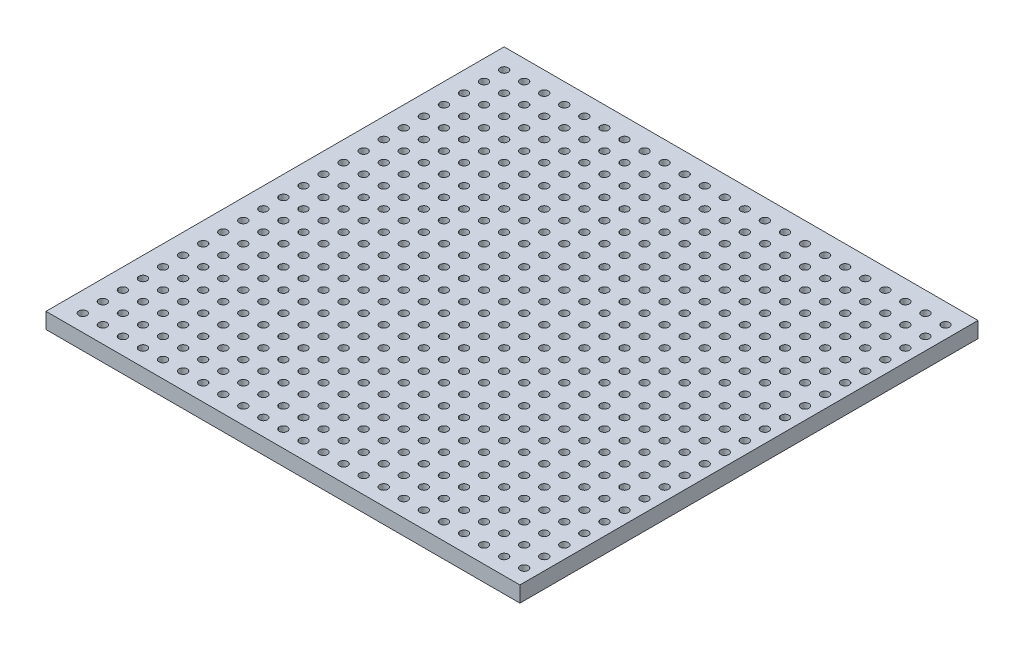
from build123d import *

# Parameters (mm, degrees)
SKETCH1_W           = 60
SKETCH1_H           = 58
BOSS_EXTRUDE1_DEPTH = 2
SKETCH2_R           = 0.51
CUT_EXTRUDE1_DEPTH  = 2


with BuildPart() as part:
    # Sketch1 → Boss-Extrude1 (new body)
    with BuildSketch(Plane(origin=(0, 0, 0), x_dir=(1, 0, 0), z_dir=(0, 1, 0))):
        Rectangle(SKETCH1_W, SKETCH1_H)
    extrude(amount=BOSS_EXTRUDE1_DEPTH)

    # Sketch2 → Cut-Extrude1 (cut)
    with BuildSketch(Plane(origin=(0, 2, 0), x_dir=(1, 0, 0), z_dir=(0, 1, 0))):
        with Locations(Location((-27.46, 26.46, 0), (0, 0, 270))):
            Circle(SKETCH2_R)
        with Locations(Location((-27.46, 23.92, 0), (0, 0, 270))):
            Circle(SKETCH2_R)
        with Locations(Location((-27.46, 21.38, 0), (0, 0, 270))):
            Circle(SKETCH2_R)
        with Locations(Location((-27.46, 18.84, 0), (0, 0, 270))):
            Circle(SKETCH2_R)
        with Locations(Location((-27.46, 16.3, 0), (0, 0, 270))):
            Circle(SKETCH2_R)
        with Locations(Location((-27.46, 13.76, 0), (0, 0, 270))):
            Circle(SKETCH2_R)
        with Locations(Location((-27.46, 11.22, 0), (0, 0, 270))):
            Circle(SKETCH2_R)
        with Locations(Location((-27.46, 8.68, 0), (0, 0, 270))):
            Circle(SKETCH2_R)
        with Locations(Location((-27.46, 6.14, 0), (0, 0, 270))):
            Circle(SKETCH2_R)
        with Locations(Location((-27.46, 3.6, 0), (0, 0, 270))):
            Circle(SKETCH2_R)
        with Locations(Location((-27.46, 1.06, 0), (0, 0, 270))):
            Circle(SKETCH2_R)
        with Locations(Location((-27.46, -1.48, 0), (0, 0, 270))):
            Circle(SKETCH2_R)
        with Locations(Location((-24.92, 26.46, 0), (0, 0, 270))):
            Circle(SKETCH2_R)
        with Locations(Location((-24.92, 23.92, 0), (0, 0, 270))):
            Circle(SKETCH2_R)
        with Locations(Location((-24.92, 21.38, 0), (0, 0, 270))):
            Circle(SKETCH2_R)
        with Locations(Location((-24.92, 18.84, 0), (0, 0, 270))):
            Circle(SKETCH2_R)
        with Locations(Location((-24.92, 16.3, 0), (0, 0, 270))):
            Circle(SKETCH2_R)
        with Locations(Location((-24.92, 13.76, 0), (0, 0, 270))):
            Circle(SKETCH2_R)
        with Locations(Location((-24.92, 11.22, 0), (0, 0, 270))):
            Circle(SKETCH2_R)
        with Locations(Location((-24.92, 8.68, 0), (0, 0, 270))):
            Circle(SKETCH2_R)
        with Locations(Location((-24.92, 6.14, 0), (0, 0, 270))):
            Circle(SKETCH2_R)
        with Locations(Location((-24.92, 3.6, 0), (0, 0, 270))):
            Circle(SKETCH2_R)
        with Locations(Location((-24.92, 1.06, 0), (0, 0, 270))):
            Circle(SKETCH2_R)
        with Locations(Location((-24.92, -1.48, 0), (0, 0, 270))):
            Circle(SKETCH2_R)
        with Locations(Location((-22.38, 26.46, 0), (0, 0, 270))):
            Circle(SKETCH2_R)
        with Locations(Location((-22.38, 23.92, 0), (0, 0, 270))):
            Circle(SKETCH2_R)
        with Locations(Location((-22.38, 21.38, 0), (0, 0, 270))):
            Circle(SKETCH2_R)
        with Locations(Location((-22.38, 18.84, 0), (0, 0, 270))):
            Circle(SKETCH2_R)
        with Locations(Location((-22.38, 16.3, 0), (0, 0, 270))):
            Circle(SKETCH2_R)
        with Locations(Location((-22.38, 13.76, 0), (0, 0, 270))):
            Circle(SKETCH2_R)
        with Locations(Location((-22.38, 11.22, 0), (0, 0, 270))):
            Circle(SKETCH2_R)
        with Locations(Location((-22.38, 8.68, 0), (0, 0, 270))):
            Circle(SKETCH2_R)
        with Locations(Location((-22.38, 6.14, 0), (0, 0, 270))):
            Circle(SKETCH2_R)
        with Locations(Location((-22.38, 3.6, 0), (0, 0, 270))):
            Circle(SKETCH2_R)
        with Locations(Location((-22.38, 1.06, 0), (0, 0, 270))):
            Circle(SKETCH2_R)
        with Locations(Location((-22.38, -1.48, 0), (0, 0, 270))):
            Circle(SKETCH2_R)
        with Locations(Location((-19.84, 26.46, 0), (0, 0, 270))):
            Circle(SKETCH2_R)
        with Locations(Location((-19.84, 23.92, 0), (0, 0, 270))):
            Circle(SKETCH2_R)
        with Locations(Location((-19.84, 21.38, 0), (0, 0, 270))):
            Circle(SKETCH2_R)
        with Locations(Location((-19.84, 18.84, 0), (0, 0, 270))):
            Circle(SKETCH2_R)
        with Locations(Location((-19.84, 16.3, 0), (0, 0, 270))):
            Circle(SKETCH2_R)
        with Locations(Location((-19.84, 13.76, 0), (0, 0, 270))):
            Circle(SKETCH2_R)
        with Locations(Location((-19.84, 11.22, 0), (0, 0, 270))):
            Circle(SKETCH2_R)
        with Locations(Location((-19.84, 8.68, 0), (0, 0, 270))):
            Circle(SKETCH2_R)
        with Locations(Location((-19.84, 6.14, 0), (0, 0, 270))):
            Circle(SKETCH2_R)
        with Locations(Location((-19.84, 3.6, 0), (0, 0, 270))):
            Circle(SKETCH2_R)
        with Locations(Location((-19.84, 1.06, 0), (0, 0, 270))):
            Circle(SKETCH2_R)
        with Locations(Location((-19.84, -1.48, 0), (0, 0, 270))):
            Circle(SKETCH2_R)
        with Locations(Location((-17.3, 26.46, 0), (0, 0, 270))):
            Circle(SKETCH2_R)
        with Locations(Location((-17.3, 23.92, 0), (0, 0, 270))):
            Circle(SKETCH2_R)
        with Locations(Location((-17.3, 21.38, 0), (0, 0, 270))):
            Circle(SKETCH2_R)
        with Locations(Location((-17.3, 18.84, 0), (0, 0, 270))):
            Circle(SKETCH2_R)
        with Locations(Location((-17.3, 16.3, 0), (0, 0, 270))):
            Circle(SKETCH2_R)
        with Locations(Location((-17.3, 13.76, 0), (0, 0, 270))):
            Circle(SKETCH2_R)
        with Locations(Location((-17.3, 11.22, 0), (0, 0, 270))):
            Circle(SKETCH2_R)
        with Locations(Location((-17.3, 8.68, 0), (0, 0, 270))):
            Circle(SKETCH2_R)
        with Locations(Location((-17.3, 6.14, 0), (0, 0, 270))):
            Circle(SKETCH2_R)
        with Locations(Location((-17.3, 3.6, 0), (0, 0, 270))):
            Circle(SKETCH2_R)
        with Locations(Location((-17.3, 1.06, 0), (0, 0, 270))):
            Circle(SKETCH2_R)
        with Locations(Location((-17.3, -1.48, 0), (0, 0, 270))):
            Circle(SKETCH2_R)
        with Locations(Location((-14.76, 26.46, 0), (0, 0, 270))):
            Circle(SKETCH2_R)
        with Locations(Location((-14.76, 23.92, 0), (0, 0, 270))):
            Circle(SKETCH2_R)
        with Locations(Location((-14.76, 21.38, 0), (0, 0, 270))):
            Circle(SKETCH2_R)
        with Locations(Location((-14.76, 18.84, 0), (0, 0, 270))):
            Circle(SKETCH2_R)
        with Locations(Location((-14.76, 16.3, 0), (0, 0, 270))):
            Circle(SKETCH2_R)
        with Locations(Location((-14.76, 13.76, 0), (0, 0, 270))):
            Circle(SKETCH2_R)
        with Locations(Location((-14.76, 11.22, 0), (0, 0, 270))):
            Circle(SKETCH2_R)
        with Locations(Location((-14.76, 8.68, 0), (0, 0, 270))):
            Circle(SKETCH2_R)
        with Locations(Location((-14.76, 6.14, 0), (0, 0, 270))):
            Circle(SKETCH2_R)
        with Locations(Location((-14.76, 3.6, 0), (0, 0, 270))):
            Circle(SKETCH2_R)
        with Locations(Location((-14.76, 1.06, 0), (0, 0, 270))):
            Circle(SKETCH2_R)
        with Locations(Location((-14.76, -1.48, 0), (0, 0, 270))):
            Circle(SKETCH2_R)
        with Locations(Location((-12.22, 26.46, 0), (0, 0, 270))):
            Circle(SKETCH2_R)
        with Locations(Location((-12.22, 23.92, 0), (0, 0, 270))):
            Circle(SKETCH2_R)
        with Locations(Location((-12.22, 21.38, 0), (0, 0, 270))):
            Circle(SKETCH2_R)
        with Locations(Location((-12.22, 18.84, 0), (0, 0, 270))):
            Circle(SKETCH2_R)
        with Locations(Location((-12.22, 16.3, 0), (0, 0, 270))):
            Circle(SKETCH2_R)
        with Locations(Location((-12.22, 13.76, 0), (0, 0, 270))):
            Circle(SKETCH2_R)
        with Locations(Location((-12.22, 11.22, 0), (0, 0, 270))):
            Circle(SKETCH2_R)
        with Locations(Location((-12.22, 8.68, 0), (0, 0, 270))):
            Circle(SKETCH2_R)
        with Locations(Location((-12.22, 6.14, 0), (0, 0, 270))):
            Circle(SKETCH2_R)
        with Locations(Location((-12.22, 3.6, 0), (0, 0, 270))):
            Circle(SKETCH2_R)
        with Locations(Location((-12.22, 1.06, 0), (0, 0, 270))):
            Circle(SKETCH2_R)
        with Locations(Location((-12.22, -1.48, 0), (0, 0, 270))):
            Circle(SKETCH2_R)
        with Locations(Location((-9.68, 26.46, 0), (0, 0, 270))):
            Circle(SKETCH2_R)
        with Locations(Location((-9.68, 23.92, 0), (0, 0, 270))):
            Circle(SKETCH2_R)
        with Locations(Location((-9.68, 21.38, 0), (0, 0, 270))):
            Circle(SKETCH2_R)
        with Locations(Location((-9.68, 18.84, 0), (0, 0, 270))):
            Circle(SKETCH2_R)
        with Locations(Location((-9.68, 16.3, 0), (0, 0, 270))):
            Circle(SKETCH2_R)
        with Locations(Location((-9.68, 13.76, 0), (0, 0, 270))):
            Circle(SKETCH2_R)
        with Locations(Location((-9.68, 11.22, 0), (0, 0, 270))):
            Circle(SKETCH2_R)
        with Locations(Location((-9.68, 8.68, 0), (0, 0, 270))):
            Circle(SKETCH2_R)
        with Locations(Location((-9.68, 6.14, 0), (0, 0, 270))):
            Circle(SKETCH2_R)
        with Locations(Location((-9.68, 3.6, 0), (0, 0, 270))):
            Circle(SKETCH2_R)
        with Locations(Location((-9.68, 1.06, 0), (0, 0, 270))):
            Circle(SKETCH2_R)
        with Locations(Location((-9.68, -1.48, 0), (0, 0, 270))):
            Circle(SKETCH2_R)
        with Locations(Location((-7.14, 26.46, 0), (0, 0, 270))):
            Circle(SKETCH2_R)
        with Locations(Location((-7.14, 23.92, 0), (0, 0, 270))):
            Circle(SKETCH2_R)
        with Locations(Location((-7.14, 21.38, 0), (0, 0, 270))):
            Circle(SKETCH2_R)
        with Locations(Location((-7.14, 18.84, 0), (0, 0, 270))):
            Circle(SKETCH2_R)
        with Locations(Location((-7.14, 16.3, 0), (0, 0, 270))):
            Circle(SKETCH2_R)
        with Locations(Location((-7.14, 13.76, 0), (0, 0, 270))):
            Circle(SKETCH2_R)
        with Locations(Location((-7.14, 11.22, 0), (0, 0, 270))):
            Circle(SKETCH2_R)
        with Locations(Location((-7.14, 8.68, 0), (0, 0, 270))):
            Circle(SKETCH2_R)
        with Locations(Location((-7.14, 6.14, 0), (0, 0, 270))):
            Circle(SKETCH2_R)
        with Locations(Location((-7.14, 3.6, 0), (0, 0, 270))):
            Circle(SKETCH2_R)
        with Locations(Location((-7.14, 1.06, 0), (0, 0, 270))):
            Circle(SKETCH2_R)
        with Locations(Location((-7.14, -1.48, 0), (0, 0, 270))):
            Circle(SKETCH2_R)
        with Locations(Location((-4.6, 26.46, 0), (0, 0, 270))):
            Circle(SKETCH2_R)
        with Locations(Location((-4.6, 23.92, 0), (0, 0, 270))):
            Circle(SKETCH2_R)
        with Locations(Location((-4.6, 21.38, 0), (0, 0, 270))):
            Circle(SKETCH2_R)
        with Locations(Location((-4.6, 18.84, 0), (0, 0, 270))):
            Circle(SKETCH2_R)
        with Locations(Location((-4.6, 16.3, 0), (0, 0, 270))):
            Circle(SKETCH2_R)
        with Locations(Location((-4.6, 13.76, 0), (0, 0, 270))):
            Circle(SKETCH2_R)
        with Locations(Location((-4.6, 11.22, 0), (0, 0, 270))):
            Circle(SKETCH2_R)
        with Locations(Location((-4.6, 8.68, 0), (0, 0, 270))):
            Circle(SKETCH2_R)
        with Locations(Location((-4.6, 6.14, 0), (0, 0, 270))):
            Circle(SKETCH2_R)
        with Locations(Location((-4.6, 3.6, 0), (0, 0, 270))):
            Circle(SKETCH2_R)
        with Locations(Location((-4.6, 1.06, 0), (0, 0, 270))):
            Circle(SKETCH2_R)
        with Locations(Location((-4.6, -1.48, 0), (0, 0, 270))):
            Circle(SKETCH2_R)
        with Locations(Location((-2.06, 26.46, 0), (0, 0, 270))):
            Circle(SKETCH2_R)
        with Locations(Location((-2.06, 23.92, 0), (0, 0, 270))):
            Circle(SKETCH2_R)
        with Locations(Location((-2.06, 21.38, 0), (0, 0, 270))):
            Circle(SKETCH2_R)
        with Locations(Location((-2.06, 18.84, 0), (0, 0, 270))):
            Circle(SKETCH2_R)
        with Locations(Location((-2.06, 16.3, 0), (0, 0, 270))):
            Circle(SKETCH2_R)
        with Locations(Location((-2.06, 13.76, 0), (0, 0, 270))):
            Circle(SKETCH2_R)
        with Locations(Location((-2.06, 11.22, 0), (0, 0, 270))):
            Circle(SKETCH2_R)
        with Locations(Location((-2.06, 8.68, 0), (0, 0, 270))):
            Circle(SKETCH2_R)
        with Locations(Location((-2.06, 6.14, 0), (0, 0, 270))):
            Circle(SKETCH2_R)
        with Locations(Location((-2.06, 3.6, 0), (0, 0, 270))):
            Circle(SKETCH2_R)
        with Locations(Location((-2.06, 1.06, 0), (0, 0, 270))):
            Circle(SKETCH2_R)
        with Locations(Location((-2.06, -1.48, 0), (0, 0, 270))):
            Circle(SKETCH2_R)
        with Locations(Location((0.48, 26.46, 0), (0, 0, 270))):
            Circle(SKETCH2_R)
        with Locations(Location((0.48, 23.92, 0), (0, 0, 270))):
            Circle(SKETCH2_R)
        with Locations(Location((0.48, 21.38, 0), (0, 0, 270))):
            Circle(SKETCH2_R)
        with Locations(Location((0.48, 18.84, 0), (0, 0, 270))):
            Circle(SKETCH2_R)
        with Locations(Location((0.48, 16.3, 0), (0, 0, 270))):
            Circle(SKETCH2_R)
        with Locations(Location((0.48, 13.76, 0), (0, 0, 270))):
            Circle(SKETCH2_R)
        with Locations(Location((0.48, 11.22, 0), (0, 0, 270))):
            Circle(SKETCH2_R)
        with Locations(Location((0.48, 8.68, 0), (0, 0, 270))):
            Circle(SKETCH2_R)
        with Locations(Location((0.48, 6.14, 0), (0, 0, 270))):
            Circle(SKETCH2_R)
        with Locations(Location((0.48, 3.6, 0), (0, 0, 270))):
            Circle(SKETCH2_R)
        with Locations(Location((0.48, 1.06, 0), (0, 0, 270))):
            Circle(SKETCH2_R)
        with Locations(Location((0.48, -1.48, 0), (0, 0, 270))):
            Circle(SKETCH2_R)
        with Locations(Location((3.02, 26.46, 0), (0, 0, 270))):
            Circle(SKETCH2_R)
        with Locations(Location((3.02, 23.92, 0), (0, 0, 270))):
            Circle(SKETCH2_R)
        with Locations(Location((3.02, 21.38, 0), (0, 0, 270))):
            Circle(SKETCH2_R)
        with Locations(Location((3.02, 18.84, 0), (0, 0, 270))):
            Circle(SKETCH2_R)
        with Locations(Location((3.02, 16.3, 0), (0, 0, 270))):
            Circle(SKETCH2_R)
        with Locations(Location((3.02, 13.76, 0), (0, 0, 270))):
            Circle(SKETCH2_R)
        with Locations(Location((3.02, 11.22, 0), (0, 0, 270))):
            Circle(SKETCH2_R)
        with Locations(Location((3.02, 8.68, 0), (0, 0, 270))):
            Circle(SKETCH2_R)
        with Locations(Location((3.02, 6.14, 0), (0, 0, 270))):
            Circle(SKETCH2_R)
        with Locations(Location((3.02, 3.6, 0), (0, 0, 270))):
            Circle(SKETCH2_R)
        with Locations(Location((3.02, 1.06, 0), (0, 0, 270))):
            Circle(SKETCH2_R)
        with Locations(Location((3.02, -1.48, 0), (0, 0, 270))):
            Circle(SKETCH2_R)
        with Locations(Location((5.56, 26.46, 0), (0, 0, 270))):
            Circle(SKETCH2_R)
        with Locations(Location((5.56, 23.92, 0), (0, 0, 270))):
            Circle(SKETCH2_R)
        with Locations(Location((5.56, 21.38, 0), (0, 0, 270))):
            Circle(SKETCH2_R)
        with Locations(Location((5.56, 18.84, 0), (0, 0, 270))):
            Circle(SKETCH2_R)
        with Locations(Location((5.56, 16.3, 0), (0, 0, 270))):
            Circle(SKETCH2_R)
        with Locations(Location((5.56, 13.76, 0), (0, 0, 270))):
            Circle(SKETCH2_R)
        with Locations(Location((5.56, 11.22, 0), (0, 0, 270))):
            Circle(SKETCH2_R)
        with Locations(Location((5.56, 8.68, 0), (0, 0, 270))):
            Circle(SKETCH2_R)
        with Locations(Location((5.56, 6.14, 0), (0, 0, 270))):
            Circle(SKETCH2_R)
        with Locations(Location((5.56, 3.6, 0), (0, 0, 270))):
            Circle(SKETCH2_R)
        with Locations(Location((5.56, 1.06, 0), (0, 0, 270))):
            Circle(SKETCH2_R)
        with Locations(Location((5.56, -1.48, 0), (0, 0, 270))):
            Circle(SKETCH2_R)
        with Locations(Location((8.1, 26.46, 0), (0, 0, 270))):
            Circle(SKETCH2_R)
        with Locations(Location((8.1, 23.92, 0), (0, 0, 270))):
            Circle(SKETCH2_R)
        with Locations(Location((8.1, 21.38, 0), (0, 0, 270))):
            Circle(SKETCH2_R)
        with Locations(Location((8.1, 18.84, 0), (0, 0, 270))):
            Circle(SKETCH2_R)
        with Locations(Location((8.1, 16.3, 0), (0, 0, 270))):
            Circle(SKETCH2_R)
        with Locations(Location((8.1, 13.76, 0), (0, 0, 270))):
            Circle(SKETCH2_R)
        with Locations(Location((8.1, 11.22, 0), (0, 0, 270))):
            Circle(SKETCH2_R)
        with Locations(Location((8.1, 8.68, 0), (0, 0, 270))):
            Circle(SKETCH2_R)
        with Locations(Location((8.1, 6.14, 0), (0, 0, 270))):
            Circle(SKETCH2_R)
        with Locations(Location((8.1, 3.6, 0), (0, 0, 270))):
            Circle(SKETCH2_R)
        with Locations(Location((8.1, 1.06, 0), (0, 0, 270))):
            Circle(SKETCH2_R)
        with Locations(Location((8.1, -1.48, 0), (0, 0, 270))):
            Circle(SKETCH2_R)
        with Locations(Location((10.64, 26.46, 0), (0, 0, 270))):
            Circle(SKETCH2_R)
        with Locations(Location((10.64, 23.92, 0), (0, 0, 270))):
            Circle(SKETCH2_R)
        with Locations(Location((10.64, 21.38, 0), (0, 0, 270))):
            Circle(SKETCH2_R)
        with Locations(Location((10.64, 18.84, 0), (0, 0, 270))):
            Circle(SKETCH2_R)
        with Locations(Location((10.64, 16.3, 0), (0, 0, 270))):
            Circle(SKETCH2_R)
        with Locations(Location((10.64, 13.76, 0), (0, 0, 270))):
            Circle(SKETCH2_R)
        with Locations(Location((10.64, 11.22, 0), (0, 0, 270))):
            Circle(SKETCH2_R)
        with Locations(Location((10.64, 8.68, 0), (0, 0, 270))):
            Circle(SKETCH2_R)
        with Locations(Location((10.64, 6.14, 0), (0, 0, 270))):
            Circle(SKETCH2_R)
        with Locations(Location((10.64, 3.6, 0), (0, 0, 270))):
            Circle(SKETCH2_R)
        with Locations(Location((10.64, 1.06, 0), (0, 0, 270))):
            Circle(SKETCH2_R)
        with Locations(Location((10.64, -1.48, 0), (0, 0, 270))):
            Circle(SKETCH2_R)
        with Locations(Location((13.18, 26.46, 0), (0, 0, 270))):
            Circle(SKETCH2_R)
        with Locations(Location((13.18, 23.92, 0), (0, 0, 270))):
            Circle(SKETCH2_R)
        with Locations(Location((13.18, 21.38, 0), (0, 0, 270))):
            Circle(SKETCH2_R)
        with Locations(Location((13.18, 18.84, 0), (0, 0, 270))):
            Circle(SKETCH2_R)
        with Locations(Location((13.18, 16.3, 0), (0, 0, 270))):
            Circle(SKETCH2_R)
        with Locations(Location((13.18, 13.76, 0), (0, 0, 270))):
            Circle(SKETCH2_R)
        with Locations(Location((13.18, 11.22, 0), (0, 0, 270))):
            Circle(SKETCH2_R)
        with Locations(Location((13.18, 8.68, 0), (0, 0, 270))):
            Circle(SKETCH2_R)
        with Locations(Location((13.18, 6.14, 0), (0, 0, 270))):
            Circle(SKETCH2_R)
        with Locations(Location((13.18, 3.6, 0), (0, 0, 270))):
            Circle(SKETCH2_R)
        with Locations(Location((13.18, 1.06, 0), (0, 0, 270))):
            Circle(SKETCH2_R)
        with Locations(Location((13.18, -1.48, 0), (0, 0, 270))):
            Circle(SKETCH2_R)
        with Locations(Location((15.72, 26.46, 0), (0, 0, 270))):
            Circle(SKETCH2_R)
        with Locations(Location((15.72, 23.92, 0), (0, 0, 270))):
            Circle(SKETCH2_R)
        with Locations(Location((15.72, 21.38, 0), (0, 0, 270))):
            Circle(SKETCH2_R)
        with Locations(Location((15.72, 18.84, 0), (0, 0, 270))):
            Circle(SKETCH2_R)
        with Locations(Location((15.72, 16.3, 0), (0, 0, 270))):
            Circle(SKETCH2_R)
        with Locations(Location((15.72, 13.76, 0), (0, 0, 270))):
            Circle(SKETCH2_R)
        with Locations(Location((15.72, 11.22, 0), (0, 0, 270))):
            Circle(SKETCH2_R)
        with Locations(Location((15.72, 8.68, 0), (0, 0, 270))):
            Circle(SKETCH2_R)
        with Locations(Location((15.72, 6.14, 0), (0, 0, 270))):
            Circle(SKETCH2_R)
        with Locations(Location((15.72, 3.6, 0), (0, 0, 270))):
            Circle(SKETCH2_R)
        with Locations(Location((15.72, 1.06, 0), (0, 0, 270))):
            Circle(SKETCH2_R)
        with Locations(Location((15.72, -1.48, 0), (0, 0, 270))):
            Circle(SKETCH2_R)
        with Locations(Location((18.26, 26.46, 0), (0, 0, 270))):
            Circle(SKETCH2_R)
        with Locations(Location((18.26, 23.92, 0), (0, 0, 270))):
            Circle(SKETCH2_R)
        with Locations(Location((18.26, 21.38, 0), (0, 0, 270))):
            Circle(SKETCH2_R)
        with Locations(Location((18.26, 18.84, 0), (0, 0, 270))):
            Circle(SKETCH2_R)
        with Locations(Location((18.26, 16.3, 0), (0, 0, 270))):
            Circle(SKETCH2_R)
        with Locations(Location((18.26, 13.76, 0), (0, 0, 270))):
            Circle(SKETCH2_R)
        with Locations(Location((18.26, 11.22, 0), (0, 0, 270))):
            Circle(SKETCH2_R)
        with Locations(Location((18.26, 8.68, 0), (0, 0, 270))):
            Circle(SKETCH2_R)
        with Locations(Location((18.26, 6.14, 0), (0, 0, 270))):
            Circle(SKETCH2_R)
        with Locations(Location((18.26, 3.6, 0), (0, 0, 270))):
            Circle(SKETCH2_R)
        with Locations(Location((18.26, 1.06, 0), (0, 0, 270))):
            Circle(SKETCH2_R)
        with Locations(Location((18.26, -1.48, 0), (0, 0, 270))):
            Circle(SKETCH2_R)
        with Locations(Location((20.8, 26.46, 0), (0, 0, 270))):
            Circle(SKETCH2_R)
        with Locations(Location((20.8, 23.92, 0), (0, 0, 270))):
            Circle(SKETCH2_R)
        with Locations(Location((20.8, 21.38, 0), (0, 0, 270))):
            Circle(SKETCH2_R)
        with Locations(Location((20.8, 18.84, 0), (0, 0, 270))):
            Circle(SKETCH2_R)
        with Locations(Location((20.8, 16.3, 0), (0, 0, 270))):
            Circle(SKETCH2_R)
        with Locations(Location((20.8, 13.76, 0), (0, 0, 270))):
            Circle(SKETCH2_R)
        with Locations(Location((20.8, 11.22, 0), (0, 0, 270))):
            Circle(SKETCH2_R)
        with Locations(Location((20.8, 8.68, 0), (0, 0, 270))):
            Circle(SKETCH2_R)
        with Locations(Location((20.8, 6.14, 0), (0, 0, 270))):
            Circle(SKETCH2_R)
        with Locations(Location((20.8, 3.6, 0), (0, 0, 270))):
            Circle(SKETCH2_R)
        with Locations(Location((20.8, 1.06, 0), (0, 0, 270))):
            Circle(SKETCH2_R)
        with Locations(Location((20.8, -1.48, 0), (0, 0, 270))):
            Circle(SKETCH2_R)
        with Locations(Location((23.34, 26.46, 0), (0, 0, 270))):
            Circle(SKETCH2_R)
        with Locations(Location((23.34, 23.92, 0), (0, 0, 270))):
            Circle(SKETCH2_R)
        with Locations(Location((23.34, 21.38, 0), (0, 0, 270))):
            Circle(SKETCH2_R)
        with Locations(Location((23.34, 18.84, 0), (0, 0, 270))):
            Circle(SKETCH2_R)
        with Locations(Location((23.34, 16.3, 0), (0, 0, 270))):
            Circle(SKETCH2_R)
        with Locations(Location((23.34, 13.76, 0), (0, 0, 270))):
            Circle(SKETCH2_R)
        with Locations(Location((23.34, 11.22, 0), (0, 0, 270))):
            Circle(SKETCH2_R)
        with Locations(Location((23.34, 8.68, 0), (0, 0, 270))):
            Circle(SKETCH2_R)
        with Locations(Location((23.34, 6.14, 0), (0, 0, 270))):
            Circle(SKETCH2_R)
        with Locations(Location((23.34, 3.6, 0), (0, 0, 270))):
            Circle(SKETCH2_R)
        with Locations(Location((23.34, 1.06, 0), (0, 0, 270))):
            Circle(SKETCH2_R)
        with Locations(Location((23.34, -1.48, 0), (0, 0, 270))):
            Circle(SKETCH2_R)
        with Locations(Location((25.88, 26.46, 0), (0, 0, 270))):
            Circle(SKETCH2_R)
        with Locations(Location((25.88, 23.92, 0), (0, 0, 270))):
            Circle(SKETCH2_R)
        with Locations(Location((25.88, 21.38, 0), (0, 0, 270))):
            Circle(SKETCH2_R)
        with Locations(Location((25.88, 18.84, 0), (0, 0, 270))):
            Circle(SKETCH2_R)
        with Locations(Location((25.88, 16.3, 0), (0, 0, 270))):
            Circle(SKETCH2_R)
        with Locations(Location((25.88, 13.76, 0), (0, 0, 270))):
            Circle(SKETCH2_R)
        with Locations(Location((25.88, 11.22, 0), (0, 0, 270))):
            Circle(SKETCH2_R)
        with Locations(Location((25.88, 8.68, 0), (0, 0, 270))):
            Circle(SKETCH2_R)
        with Locations(Location((25.88, 6.14, 0), (0, 0, 270))):
            Circle(SKETCH2_R)
        with Locations(Location((25.88, 3.6, 0), (0, 0, 270))):
            Circle(SKETCH2_R)
        with Locations(Location((25.88, 1.06, 0), (0, 0, 270))):
            Circle(SKETCH2_R)
        with Locations(Location((25.88, -1.48, 0), (0, 0, 270))):
            Circle(SKETCH2_R)
        with Locations(Location((28.42, 26.46, 0), (0, 0, 270))):
            Circle(SKETCH2_R)
        with Locations(Location((28.42, 23.92, 0), (0, 0, 270))):
            Circle(SKETCH2_R)
        with Locations(Location((28.42, 21.38, 0), (0, 0, 270))):
            Circle(SKETCH2_R)
        with Locations(Location((28.42, 18.84, 0), (0, 0, 270))):
            Circle(SKETCH2_R)
        with Locations(Location((28.42, 16.3, 0), (0, 0, 270))):
            Circle(SKETCH2_R)
        with Locations(Location((28.42, 13.76, 0), (0, 0, 270))):
            Circle(SKETCH2_R)
        with Locations(Location((28.42, 11.22, 0), (0, 0, 270))):
            Circle(SKETCH2_R)
        with Locations(Location((28.42, 8.68, 0), (0, 0, 270))):
            Circle(SKETCH2_R)
        with Locations(Location((28.42, 6.14, 0), (0, 0, 270))):
            Circle(SKETCH2_R)
        with Locations(Location((28.42, 3.6, 0), (0, 0, 270))):
            Circle(SKETCH2_R)
        with Locations(Location((28.42, 1.06, 0), (0, 0, 270))):
            Circle(SKETCH2_R)
        with Locations(Location((28.42, -1.48, 0), (0, 0, 270))):
            Circle(SKETCH2_R)
        with Locations(Location((-27.46, -4.02, 0), (0, 0, 270))):
            Circle(SKETCH2_R)
        with Locations(Location((-24.92, -4.02, 0), (0, 0, 270))):
            Circle(SKETCH2_R)
        with Locations(Location((-22.38, -4.02, 0), (0, 0, 270))):
            Circle(SKETCH2_R)
        with Locations(Location((-19.84, -4.02, 0), (0, 0, 270))):
            Circle(SKETCH2_R)
        with Locations(Location((-17.3, -4.02, 0), (0, 0, 270))):
            Circle(SKETCH2_R)
        with Locations(Location((-14.76, -4.02, 0), (0, 0, 270))):
            Circle(SKETCH2_R)
        with Locations(Location((-12.22, -4.02, 0), (0, 0, 270))):
            Circle(SKETCH2_R)
        with Locations(Location((-9.68, -4.02, 0), (0, 0, 270))):
            Circle(SKETCH2_R)
        with Locations(Location((-7.14, -4.02, 0), (0, 0, 270))):
            Circle(SKETCH2_R)
        with Locations(Location((-4.6, -4.02, 0), (0, 0, 270))):
            Circle(SKETCH2_R)
        with Locations(Location((-2.06, -4.02, 0), (0, 0, 270))):
            Circle(SKETCH2_R)
        with Locations(Location((0.48, -4.02, 0), (0, 0, 270))):
            Circle(SKETCH2_R)
        with Locations(Location((3.02, -4.02, 0), (0, 0, 270))):
            Circle(SKETCH2_R)
        with Locations(Location((5.56, -4.02, 0), (0, 0, 270))):
            Circle(SKETCH2_R)
        with Locations(Location((8.1, -4.02, 0), (0, 0, 270))):
            Circle(SKETCH2_R)
        with Locations(Location((10.64, -4.02, 0), (0, 0, 270))):
            Circle(SKETCH2_R)
        with Locations(Location((13.18, -4.02, 0), (0, 0, 270))):
            Circle(SKETCH2_R)
        with Locations(Location((15.72, -4.02, 0), (0, 0, 270))):
            Circle(SKETCH2_R)
        with Locations(Location((18.26, -4.02, 0), (0, 0, 270))):
            Circle(SKETCH2_R)
        with Locations(Location((20.8, -4.02, 0), (0, 0, 270))):
            Circle(SKETCH2_R)
        with Locations(Location((23.34, -4.02, 0), (0, 0, 270))):
            Circle(SKETCH2_R)
        with Locations(Location((25.88, -4.02, 0), (0, 0, 270))):
            Circle(SKETCH2_R)
        with Locations(Location((28.42, -4.02, 0), (0, 0, 270))):
            Circle(SKETCH2_R)
        with Locations(Location((-27.46, -6.56, 0), (0, 0, 270))):
            Circle(SKETCH2_R)
        with Locations(Location((-24.92, -6.56, 0), (0, 0, 270))):
            Circle(SKETCH2_R)
        with Locations(Location((-22.38, -6.56, 0), (0, 0, 270))):
            Circle(SKETCH2_R)
        with Locations(Location((-19.84, -6.56, 0), (0, 0, 270))):
            Circle(SKETCH2_R)
        with Locations(Location((-17.3, -6.56, 0), (0, 0, 270))):
            Circle(SKETCH2_R)
        with Locations(Location((-14.76, -6.56, 0), (0, 0, 270))):
            Circle(SKETCH2_R)
        with Locations(Location((-12.22, -6.56, 0), (0, 0, 270))):
            Circle(SKETCH2_R)
        with Locations(Location((-9.68, -6.56, 0), (0, 0, 270))):
            Circle(SKETCH2_R)
        with Locations(Location((-7.14, -6.56, 0), (0, 0, 270))):
            Circle(SKETCH2_R)
        with Locations(Location((-4.6, -6.56, 0), (0, 0, 270))):
            Circle(SKETCH2_R)
        with Locations(Location((-2.06, -6.56, 0), (0, 0, 270))):
            Circle(SKETCH2_R)
        with Locations(Location((0.48, -6.56, 0), (0, 0, 270))):
            Circle(SKETCH2_R)
        with Locations(Location((3.02, -6.56, 0), (0, 0, 270))):
            Circle(SKETCH2_R)
        with Locations(Location((5.56, -6.56, 0), (0, 0, 270))):
            Circle(SKETCH2_R)
        with Locations(Location((8.1, -6.56, 0), (0, 0, 270))):
            Circle(SKETCH2_R)
        with Locations(Location((10.64, -6.56, 0), (0, 0, 270))):
            Circle(SKETCH2_R)
        with Locations(Location((13.18, -6.56, 0), (0, 0, 270))):
            Circle(SKETCH2_R)
        with Locations(Location((15.72, -6.56, 0), (0, 0, 270))):
            Circle(SKETCH2_R)
        with Locations(Location((18.26, -6.56, 0), (0, 0, 270))):
            Circle(SKETCH2_R)
        with Locations(Location((20.8, -6.56, 0), (0, 0, 270))):
            Circle(SKETCH2_R)
        with Locations(Location((23.34, -6.56, 0), (0, 0, 270))):
            Circle(SKETCH2_R)
        with Locations(Location((25.88, -6.56, 0), (0, 0, 270))):
            Circle(SKETCH2_R)
        with Locations(Location((28.42, -6.56, 0), (0, 0, 270))):
            Circle(SKETCH2_R)
        with Locations(Location((-27.46, -9.1, 0), (0, 0, 270))):
            Circle(SKETCH2_R)
        with Locations(Location((-24.92, -9.1, 0), (0, 0, 270))):
            Circle(SKETCH2_R)
        with Locations(Location((-22.38, -9.1, 0), (0, 0, 270))):
            Circle(SKETCH2_R)
        with Locations(Location((-19.84, -9.1, 0), (0, 0, 270))):
            Circle(SKETCH2_R)
        with Locations(Location((-17.3, -9.1, 0), (0, 0, 270))):
            Circle(SKETCH2_R)
        with Locations(Location((-14.76, -9.1, 0), (0, 0, 270))):
            Circle(SKETCH2_R)
        with Locations(Location((-12.22, -9.1, 0), (0, 0, 270))):
            Circle(SKETCH2_R)
        with Locations(Location((-9.68, -9.1, 0), (0, 0, 270))):
            Circle(SKETCH2_R)
        with Locations(Location((-7.14, -9.1, 0), (0, 0, 270))):
            Circle(SKETCH2_R)
        with Locations(Location((-4.6, -9.1, 0), (0, 0, 270))):
            Circle(SKETCH2_R)
        with Locations(Location((-2.06, -9.1, 0), (0, 0, 270))):
            Circle(SKETCH2_R)
        with Locations(Location((0.48, -9.1, 0), (0, 0, 270))):
            Circle(SKETCH2_R)
        with Locations(Location((3.02, -9.1, 0), (0, 0, 270))):
            Circle(SKETCH2_R)
        with Locations(Location((5.56, -9.1, 0), (0, 0, 270))):
            Circle(SKETCH2_R)
        with Locations(Location((8.1, -9.1, 0), (0, 0, 270))):
            Circle(SKETCH2_R)
        with Locations(Location((10.64, -9.1, 0), (0, 0, 270))):
            Circle(SKETCH2_R)
        with Locations(Location((13.18, -9.1, 0), (0, 0, 270))):
            Circle(SKETCH2_R)
        with Locations(Location((15.72, -9.1, 0), (0, 0, 270))):
            Circle(SKETCH2_R)
        with Locations(Location((18.26, -9.1, 0), (0, 0, 270))):
            Circle(SKETCH2_R)
        with Locations(Location((20.8, -9.1, 0), (0, 0, 270))):
            Circle(SKETCH2_R)
        with Locations(Location((23.34, -9.1, 0), (0, 0, 270))):
            Circle(SKETCH2_R)
        with Locations(Location((25.88, -9.1, 0), (0, 0, 270))):
            Circle(SKETCH2_R)
        with Locations(Location((28.42, -9.1, 0), (0, 0, 270))):
            Circle(SKETCH2_R)
        with Locations(Location((-27.46, -11.64, 0), (0, 0, 270))):
            Circle(SKETCH2_R)
        with Locations(Location((-24.92, -11.64, 0), (0, 0, 270))):
            Circle(SKETCH2_R)
        with Locations(Location((-22.38, -11.64, 0), (0, 0, 270))):
            Circle(SKETCH2_R)
        with Locations(Location((-19.84, -11.64, 0), (0, 0, 270))):
            Circle(SKETCH2_R)
        with Locations(Location((-17.3, -11.64, 0), (0, 0, 270))):
            Circle(SKETCH2_R)
        with Locations(Location((-14.76, -11.64, 0), (0, 0, 270))):
            Circle(SKETCH2_R)
        with Locations(Location((-12.22, -11.64, 0), (0, 0, 270))):
            Circle(SKETCH2_R)
        with Locations(Location((-9.68, -11.64, 0), (0, 0, 270))):
            Circle(SKETCH2_R)
        with Locations(Location((-7.14, -11.64, 0), (0, 0, 270))):
            Circle(SKETCH2_R)
        with Locations(Location((-4.6, -11.64, 0), (0, 0, 270))):
            Circle(SKETCH2_R)
        with Locations(Location((-2.06, -11.64, 0), (0, 0, 270))):
            Circle(SKETCH2_R)
        with Locations(Location((0.48, -11.64, 0), (0, 0, 270))):
            Circle(SKETCH2_R)
        with Locations(Location((3.02, -11.64, 0), (0, 0, 270))):
            Circle(SKETCH2_R)
        with Locations(Location((5.56, -11.64, 0), (0, 0, 270))):
            Circle(SKETCH2_R)
        with Locations(Location((8.1, -11.64, 0), (0, 0, 270))):
            Circle(SKETCH2_R)
        with Locations(Location((10.64, -11.64, 0), (0, 0, 270))):
            Circle(SKETCH2_R)
        with Locations(Location((13.18, -11.64, 0), (0, 0, 270))):
            Circle(SKETCH2_R)
        with Locations(Location((15.72, -11.64, 0), (0, 0, 270))):
            Circle(SKETCH2_R)
        with Locations(Location((18.26, -11.64, 0), (0, 0, 270))):
            Circle(SKETCH2_R)
        with Locations(Location((20.8, -11.64, 0), (0, 0, 270))):
            Circle(SKETCH2_R)
        with Locations(Location((23.34, -11.64, 0), (0, 0, 270))):
            Circle(SKETCH2_R)
        with Locations(Location((25.88, -11.64, 0), (0, 0, 270))):
            Circle(SKETCH2_R)
        with Locations(Location((28.42, -11.64, 0), (0, 0, 270))):
            Circle(SKETCH2_R)
        with Locations(Location((-27.46, -14.18, 0), (0, 0, 270))):
            Circle(SKETCH2_R)
        with Locations(Location((-24.92, -14.18, 0), (0, 0, 270))):
            Circle(SKETCH2_R)
        with Locations(Location((-22.38, -14.18, 0), (0, 0, 270))):
            Circle(SKETCH2_R)
        with Locations(Location((-19.84, -14.18, 0), (0, 0, 270))):
            Circle(SKETCH2_R)
        with Locations(Location((-17.3, -14.18, 0), (0, 0, 270))):
            Circle(SKETCH2_R)
        with Locations(Location((-14.76, -14.18, 0), (0, 0, 270))):
            Circle(SKETCH2_R)
        with Locations(Location((-12.22, -14.18, 0), (0, 0, 270))):
            Circle(SKETCH2_R)
        with Locations(Location((-9.68, -14.18, 0), (0, 0, 270))):
            Circle(SKETCH2_R)
        with Locations(Location((-7.14, -14.18, 0), (0, 0, 270))):
            Circle(SKETCH2_R)
        with Locations(Location((-4.6, -14.18, 0), (0, 0, 270))):
            Circle(SKETCH2_R)
        with Locations(Location((-2.06, -14.18, 0), (0, 0, 270))):
            Circle(SKETCH2_R)
        with Locations(Location((0.48, -14.18, 0), (0, 0, 270))):
            Circle(SKETCH2_R)
        with Locations(Location((3.02, -14.18, 0), (0, 0, 270))):
            Circle(SKETCH2_R)
        with Locations(Location((5.56, -14.18, 0), (0, 0, 270))):
            Circle(SKETCH2_R)
        with Locations(Location((8.1, -14.18, 0), (0, 0, 270))):
            Circle(SKETCH2_R)
        with Locations(Location((10.64, -14.18, 0), (0, 0, 270))):
            Circle(SKETCH2_R)
        with Locations(Location((13.18, -14.18, 0), (0, 0, 270))):
            Circle(SKETCH2_R)
        with Locations(Location((15.72, -14.18, 0), (0, 0, 270))):
            Circle(SKETCH2_R)
        with Locations(Location((18.26, -14.18, 0), (0, 0, 270))):
            Circle(SKETCH2_R)
        with Locations(Location((20.8, -14.18, 0), (0, 0, 270))):
            Circle(SKETCH2_R)
        with Locations(Location((23.34, -14.18, 0), (0, 0, 270))):
            Circle(SKETCH2_R)
        with Locations(Location((25.88, -14.18, 0), (0, 0, 270))):
            Circle(SKETCH2_R)
        with Locations(Location((28.42, -14.18, 0), (0, 0, 270))):
            Circle(SKETCH2_R)
        with Locations(Location((-27.46, -16.72, 0), (0, 0, 270))):
            Circle(SKETCH2_R)
        with Locations(Location((-24.92, -16.72, 0), (0, 0, 270))):
            Circle(SKETCH2_R)
        with Locations(Location((-22.38, -16.72, 0), (0, 0, 270))):
            Circle(SKETCH2_R)
        with Locations(Location((-19.84, -16.72, 0), (0, 0, 270))):
            Circle(SKETCH2_R)
        with Locations(Location((-17.3, -16.72, 0), (0, 0, 270))):
            Circle(SKETCH2_R)
        with Locations(Location((-14.76, -16.72, 0), (0, 0, 270))):
            Circle(SKETCH2_R)
        with Locations(Location((-12.22, -16.72, 0), (0, 0, 270))):
            Circle(SKETCH2_R)
        with Locations(Location((-9.68, -16.72, 0), (0, 0, 270))):
            Circle(SKETCH2_R)
        with Locations(Location((-7.14, -16.72, 0), (0, 0, 270))):
            Circle(SKETCH2_R)
        with Locations(Location((-4.6, -16.72, 0), (0, 0, 270))):
            Circle(SKETCH2_R)
        with Locations(Location((-2.06, -16.72, 0), (0, 0, 270))):
            Circle(SKETCH2_R)
        with Locations(Location((0.48, -16.72, 0), (0, 0, 270))):
            Circle(SKETCH2_R)
        with Locations(Location((3.02, -16.72, 0), (0, 0, 270))):
            Circle(SKETCH2_R)
        with Locations(Location((5.56, -16.72, 0), (0, 0, 270))):
            Circle(SKETCH2_R)
        with Locations(Location((8.1, -16.72, 0), (0, 0, 270))):
            Circle(SKETCH2_R)
        with Locations(Location((10.64, -16.72, 0), (0, 0, 270))):
            Circle(SKETCH2_R)
        with Locations(Location((13.18, -16.72, 0), (0, 0, 270))):
            Circle(SKETCH2_R)
        with Locations(Location((15.72, -16.72, 0), (0, 0, 270))):
            Circle(SKETCH2_R)
        with Locations(Location((18.26, -16.72, 0), (0, 0, 270))):
            Circle(SKETCH2_R)
        with Locations(Location((20.8, -16.72, 0), (0, 0, 270))):
            Circle(SKETCH2_R)
        with Locations(Location((23.34, -16.72, 0), (0, 0, 270))):
            Circle(SKETCH2_R)
        with Locations(Location((25.88, -16.72, 0), (0, 0, 270))):
            Circle(SKETCH2_R)
        with Locations(Location((28.42, -16.72, 0), (0, 0, 270))):
            Circle(SKETCH2_R)
        with Locations(Location((-27.46, -19.26, 0), (0, 0, 270))):
            Circle(SKETCH2_R)
        with Locations(Location((-24.92, -19.26, 0), (0, 0, 270))):
            Circle(SKETCH2_R)
        with Locations(Location((-22.38, -19.26, 0), (0, 0, 270))):
            Circle(SKETCH2_R)
        with Locations(Location((-19.84, -19.26, 0), (0, 0, 270))):
            Circle(SKETCH2_R)
        with Locations(Location((-17.3, -19.26, 0), (0, 0, 270))):
            Circle(SKETCH2_R)
        with Locations(Location((-14.76, -19.26, 0), (0, 0, 270))):
            Circle(SKETCH2_R)
        with Locations(Location((-12.22, -19.26, 0), (0, 0, 270))):
            Circle(SKETCH2_R)
        with Locations(Location((-9.68, -19.26, 0), (0, 0, 270))):
            Circle(SKETCH2_R)
        with Locations(Location((-7.14, -19.26, 0), (0, 0, 270))):
            Circle(SKETCH2_R)
        with Locations(Location((-4.6, -19.26, 0), (0, 0, 270))):
            Circle(SKETCH2_R)
        with Locations(Location((-2.06, -19.26, 0), (0, 0, 270))):
            Circle(SKETCH2_R)
        with Locations(Location((0.48, -19.26, 0), (0, 0, 270))):
            Circle(SKETCH2_R)
        with Locations(Location((3.02, -19.26, 0), (0, 0, 270))):
            Circle(SKETCH2_R)
        with Locations(Location((5.56, -19.26, 0), (0, 0, 270))):
            Circle(SKETCH2_R)
        with Locations(Location((8.1, -19.26, 0), (0, 0, 270))):
            Circle(SKETCH2_R)
        with Locations(Location((10.64, -19.26, 0), (0, 0, 270))):
            Circle(SKETCH2_R)
        with Locations(Location((13.18, -19.26, 0), (0, 0, 270))):
            Circle(SKETCH2_R)
        with Locations(Location((15.72, -19.26, 0), (0, 0, 270))):
            Circle(SKETCH2_R)
        with Locations(Location((18.26, -19.26, 0), (0, 0, 270))):
            Circle(SKETCH2_R)
        with Locations(Location((20.8, -19.26, 0), (0, 0, 270))):
            Circle(SKETCH2_R)
        with Locations(Location((23.34, -19.26, 0), (0, 0, 270))):
            Circle(SKETCH2_R)
        with Locations(Location((25.88, -19.26, 0), (0, 0, 270))):
            Circle(SKETCH2_R)
        with Locations(Location((28.42, -19.26, 0), (0, 0, 270))):
            Circle(SKETCH2_R)
        with Locations(Location((-27.46, -21.8, 0), (0, 0, 270))):
            Circle(SKETCH2_R)
        with Locations(Location((-24.92, -21.8, 0), (0, 0, 270))):
            Circle(SKETCH2_R)
        with Locations(Location((-22.38, -21.8, 0), (0, 0, 270))):
            Circle(SKETCH2_R)
        with Locations(Location((-19.84, -21.8, 0), (0, 0, 270))):
            Circle(SKETCH2_R)
        with Locations(Location((-17.3, -21.8, 0), (0, 0, 270))):
            Circle(SKETCH2_R)
        with Locations(Location((-14.76, -21.8, 0), (0, 0, 270))):
            Circle(SKETCH2_R)
        with Locations(Location((-12.22, -21.8, 0), (0, 0, 270))):
            Circle(SKETCH2_R)
        with Locations(Location((-9.68, -21.8, 0), (0, 0, 270))):
            Circle(SKETCH2_R)
        with Locations(Location((-7.14, -21.8, 0), (0, 0, 270))):
            Circle(SKETCH2_R)
        with Locations(Location((-4.6, -21.8, 0), (0, 0, 270))):
            Circle(SKETCH2_R)
        with Locations(Location((-2.06, -21.8, 0), (0, 0, 270))):
            Circle(SKETCH2_R)
        with Locations(Location((0.48, -21.8, 0), (0, 0, 270))):
            Circle(SKETCH2_R)
        with Locations(Location((3.02, -21.8, 0), (0, 0, 270))):
            Circle(SKETCH2_R)
        with Locations(Location((5.56, -21.8, 0), (0, 0, 270))):
            Circle(SKETCH2_R)
        with Locations(Location((8.1, -21.8, 0), (0, 0, 270))):
            Circle(SKETCH2_R)
        with Locations(Location((10.64, -21.8, 0), (0, 0, 270))):
            Circle(SKETCH2_R)
        with Locations(Location((13.18, -21.8, 0), (0, 0, 270))):
            Circle(SKETCH2_R)
        with Locations(Location((15.72, -21.8, 0), (0, 0, 270))):
            Circle(SKETCH2_R)
        with Locations(Location((18.26, -21.8, 0), (0, 0, 270))):
            Circle(SKETCH2_R)
        with Locations(Location((20.8, -21.8, 0), (0, 0, 270))):
            Circle(SKETCH2_R)
        with Locations(Location((23.34, -21.8, 0), (0, 0, 270))):
            Circle(SKETCH2_R)
        with Locations(Location((25.88, -21.8, 0), (0, 0, 270))):
            Circle(SKETCH2_R)
        with Locations(Location((28.42, -21.8, 0), (0, 0, 270))):
            Circle(SKETCH2_R)
        with Locations(Location((-27.46, -24.34, 0), (0, 0, 270))):
            Circle(SKETCH2_R)
        with Locations(Location((-24.92, -24.34, 0), (0, 0, 270))):
            Circle(SKETCH2_R)
        with Locations(Location((-22.38, -24.34, 0), (0, 0, 270))):
            Circle(SKETCH2_R)
        with Locations(Location((-19.84, -24.34, 0), (0, 0, 270))):
            Circle(SKETCH2_R)
        with Locations(Location((-17.3, -24.34, 0), (0, 0, 270))):
            Circle(SKETCH2_R)
        with Locations(Location((-14.76, -24.34, 0), (0, 0, 270))):
            Circle(SKETCH2_R)
        with Locations(Location((-12.22, -24.34, 0), (0, 0, 270))):
            Circle(SKETCH2_R)
        with Locations(Location((-9.68, -24.34, 0), (0, 0, 270))):
            Circle(SKETCH2_R)
        with Locations(Location((-7.14, -24.34, 0), (0, 0, 270))):
            Circle(SKETCH2_R)
        with Locations(Location((-4.6, -24.34, 0), (0, 0, 270))):
            Circle(SKETCH2_R)
        with Locations(Location((-2.06, -24.34, 0), (0, 0, 270))):
            Circle(SKETCH2_R)
        with Locations(Location((0.48, -24.34, 0), (0, 0, 270))):
            Circle(SKETCH2_R)
        with Locations(Location((3.02, -24.34, 0), (0, 0, 270))):
            Circle(SKETCH2_R)
        with Locations(Location((5.56, -24.34, 0), (0, 0, 270))):
            Circle(SKETCH2_R)
        with Locations(Location((8.1, -24.34, 0), (0, 0, 270))):
            Circle(SKETCH2_R)
        with Locations(Location((10.64, -24.34, 0), (0, 0, 270))):
            Circle(SKETCH2_R)
        with Locations(Location((13.18, -24.34, 0), (0, 0, 270))):
            Circle(SKETCH2_R)
        with Locations(Location((15.72, -24.34, 0), (0, 0, 270))):
            Circle(SKETCH2_R)
        with Locations(Location((18.26, -24.34, 0), (0, 0, 270))):
            Circle(SKETCH2_R)
        with Locations(Location((20.8, -24.34, 0), (0, 0, 270))):
            Circle(SKETCH2_R)
        with Locations(Location((23.34, -24.34, 0), (0, 0, 270))):
            Circle(SKETCH2_R)
        with Locations(Location((25.88, -24.34, 0), (0, 0, 270))):
            Circle(SKETCH2_R)
        with Locations(Location((28.42, -24.34, 0), (0, 0, 270))):
            Circle(SKETCH2_R)
        with Locations(Location((-27.46, -26.88, 0), (0, 0, 270))):
            Circle(SKETCH2_R)
        with Locations(Location((-24.92, -26.88, 0), (0, 0, 270))):
            Circle(SKETCH2_R)
        with Locations(Location((-22.38, -26.88, 0), (0, 0, 270))):
            Circle(SKETCH2_R)
        with Locations(Location((-19.84, -26.88, 0), (0, 0, 270))):
            Circle(SKETCH2_R)
        with Locations(Location((-17.3, -26.88, 0), (0, 0, 270))):
            Circle(SKETCH2_R)
        with Locations(Location((-14.76, -26.88, 0), (0, 0, 270))):
            Circle(SKETCH2_R)
        with Locations(Location((-12.22, -26.88, 0), (0, 0, 270))):
            Circle(SKETCH2_R)
        with Locations(Location((-9.68, -26.88, 0), (0, 0, 270))):
            Circle(SKETCH2_R)
        with Locations(Location((-7.14, -26.88, 0), (0, 0, 270))):
            Circle(SKETCH2_R)
        with Locations(Location((-4.6, -26.88, 0), (0, 0, 270))):
            Circle(SKETCH2_R)
        with Locations(Location((-2.06, -26.88, 0), (0, 0, 270))):
            Circle(SKETCH2_R)
        with Locations(Location((0.48, -26.88, 0), (0, 0, 270))):
            Circle(SKETCH2_R)
        with Locations(Location((3.02, -26.88, 0), (0, 0, 270))):
            Circle(SKETCH2_R)
        with Locations(Location((5.56, -26.88, 0), (0, 0, 270))):
            Circle(SKETCH2_R)
        with Locations(Location((8.1, -26.88, 0), (0, 0, 270))):
            Circle(SKETCH2_R)
        with Locations(Location((10.64, -26.88, 0), (0, 0, 270))):
            Circle(SKETCH2_R)
        with Locations(Location((13.18, -26.88, 0), (0, 0, 270))):
            Circle(SKETCH2_R)
        with Locations(Location((15.72, -26.88, 0), (0, 0, 270))):
            Circle(SKETCH2_R)
        with Locations(Location((18.26, -26.88, 0), (0, 0, 270))):
            Circle(SKETCH2_R)
        with Locations(Location((20.8, -26.88, 0), (0, 0, 270))):
            Circle(SKETCH2_R)
        with Locations(Location((23.34, -26.88, 0), (0, 0, 270))):
            Circle(SKETCH2_R)
        with Locations(Location((25.88, -26.88, 0), (0, 0, 270))):
            Circle(SKETCH2_R)
        with Locations(Location((28.42, -26.88, 0), (0, 0, 270))):
            Circle(SKETCH2_R)
    extrude(amount=-CUT_EXTRUDE1_DEPTH, mode=Mode.SUBTRACT)


solid = part.part
